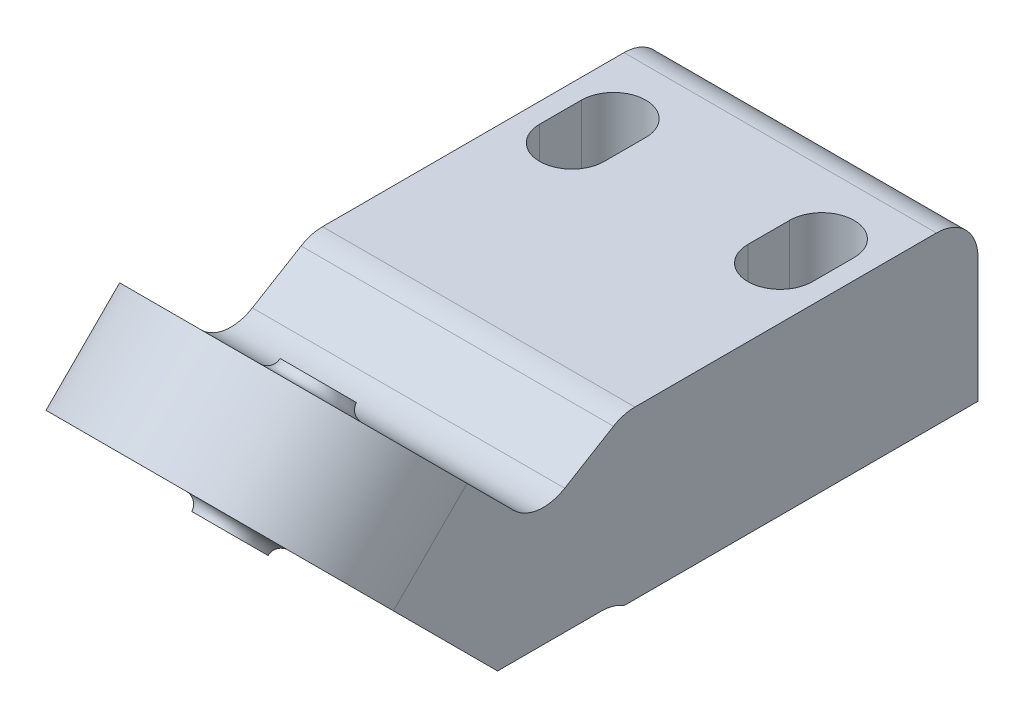
from build123d import *

# Parameters (mm, degrees)
SKETCH_10_W         = 15
SKETCH_10_H         = 8
EXTRUDE_7_DEPTH     = 11
CUT_EXTRUDE_4_DEPTH = 11
SKETCH_12_W         = 15
SKETCH_12_H         = 6
EXTRUDE_8_DEPTH     = 6
SKETCH_14_W         = 15
SKETCH_14_H         = 5
EXTRUDE_9_DEPTH     = 4
EXTRUDE_10_DEPTH    = 15
EXTRUDE_11_DEPTH    = 5
SKETCH_19_R         = 1.1
CUT_EXTRUDE_5_DEPTH = 5
EXTRUDE_START       = 0.5
SKETCH_20_R         = 1.5
SKETCH_20_R_2       = 1.1
EXTRUDE_12_DEPTH    = 0.5
SKETCH_21_R         = 1.5
SKETCH_21_R_2       = 1.1
EXTRUDE_13_DEPTH    = 0.5
FILLET_4_R          = 0.5
CHAMFER_1_SIZE      = 4.493554602
CHAMFER_1_SIZE_2    = 2.7
FILLET_7_R          = 2
SKETCH_22_W         = 15
SKETCH_22_H         = 2
EXTRUDE_14_DEPTH    = 6
FILLET_8_R          = 2
FILLET_9_R          = 2


# Some blends are built 0.0001 mm under size
with BuildPart() as part:
    # 草图10 → 凸台-拉伸7 (new body)
    with BuildSketch(Plane.XY):
        with Locations((0, 24.68211788)):
            Rectangle(SKETCH_10_W, SKETCH_10_H)
    extrude(amount=EXTRUDE_7_DEPTH)

    # 草图11 → 切除-拉伸4 (cut)
    with BuildSketch(Plane(origin=(0, 28.68211788, 0), x_dir=(1, 0, 0), z_dir=(0, 1, 0))):
        with BuildLine():
            Line((-3.45, -5), (-3.45, -7))
            ThreePointArc((-3.45, -7), (-5, -8.55), (-6.55, -7))
            Line((-6.55, -7), (-6.55, -5))
            ThreePointArc((-6.55, -5), (-5, -3.45), (-3.45, -5))
        make_face()
        with BuildLine():
            Line((3.45, -5), (3.45, -7))
            ThreePointArc((3.45, -7), (5, -8.55), (6.55, -7))
            Line((6.55, -7), (6.55, -5))
            ThreePointArc((6.55, -5), (5, -3.45), (3.45, -5))
        make_face()
    extrude(amount=-CUT_EXTRUDE_4_DEPTH, mode=Mode.SUBTRACT)

    # 草图12 → 凸台-拉伸8 (add)
    with BuildSketch(Plane.XY.offset(11)):
        with Locations((0, 25.68211788)):
            Rectangle(SKETCH_12_W, SKETCH_12_H)
    extrude(amount=EXTRUDE_8_DEPTH)

    # 草图14 → 凸台-拉伸9 (add)
    with BuildSketch(Plane.XY.offset(17)):
        with Locations((0, 23.5)):
            Rectangle(SKETCH_14_W, SKETCH_14_H)
    extrude(amount=EXTRUDE_9_DEPTH)

    # 草图17 → 凸台-拉伸10 (add)
    with BuildSketch(Plane.ZY.offset(7.5)):
        Polygon((21, 26), (24.535533906, 29.535533906), (28.071067812, 26), (23.071067812, 21), (21, 21), align=None)
    extrude(amount=-EXTRUDE_10_DEPTH)

    # 草图18 → 凸台-拉伸11 (add)
    with BuildSketch(Plane(origin=(0, -1.035533906, 1.035533906), x_dir=(1, 0, 0), z_dir=(0, -0.7071067811865507, 0.7071067811865445))):
        with BuildLine():
            Line((7.5, 38.234018716), (-7.5, 38.234018716))
            ThreePointArc((-7.5, 38.234018716), (0, 45.734018716), (7.5, 38.234018716))
        make_face()
    extrude(amount=-EXTRUDE_11_DEPTH)

    # 草图19 → 切除-拉伸5 (cut)
    with BuildSketch(Plane(origin=(0, -1.035533906, 1.035533906), x_dir=(1, 0, 0), z_dir=(0, -0.7071067811865507, 0.7071067811865445))):
        with Locations(Location((0, 38.234018716, 0), (0, 0, 270))):
            Circle(SKETCH_19_R)
    extrude(amount=-CUT_EXTRUDE_5_DEPTH, mode=Mode.SUBTRACT)

    # 草图20 → 凸台-拉伸12 (add)
    with BuildSketch(Plane(origin=(0, -1.035533906, 1.035533906), x_dir=(1, 0, 0), z_dir=(0, -0.7071067811865507, 0.7071067811865445)).offset(EXTRUDE_START)):
        with Locations(Location((0, 38.234018716, 0), (0, 0, 270))):
            Circle(SKETCH_20_R)
        with Locations(Location((0, 38.234018716, 0), (0, 0, 270))):
            Circle(SKETCH_20_R_2, mode=Mode.SUBTRACT)
    extrude(amount=-EXTRUDE_12_DEPTH)

    # 草图21 → 凸台-拉伸13 (add)
    with BuildSketch(Plane(origin=(0, 2.5, -2.5), x_dir=(1, 0, 0), z_dir=(0, 0.7071067811865513, -0.7071067811865437))):
        with Locations(Location((0, -38.234018716, 0), (0, 0, 90))):
            Circle(SKETCH_21_R)
        with Locations(Location((0, -38.234018716, 0), (0, 0, 90))):
            Circle(SKETCH_21_R_2, mode=Mode.SUBTRACT)
    extrude(amount=EXTRUDE_13_DEPTH)

    # 圆角4
    fillet_4_edges = [part.edges().sort_by_distance(p)[0] for p in [
        (0, 27.060660172, 29.131727984),
        (0, 30.596194078, 25.596194078),
    ]]
    fillet(fillet_4_edges, radius=FILLET_4_R - 0.0001)  # a hair under: the kernel refuses the full size

    # 倒角1
    # the kernel refuses this chamfer: 4.493554602, 2.7 mm, written as the material it adds along each edge
    with BuildSketch(Plane(origin=(-7.5, 26, 17), x_dir=(0, -0.01991463058083334, 0.9998016840798123), z_dir=(1, 0, 0))) as chamfer_1_piece_1_section:
        Polygon((CHAMFER_1_SIZE * 0.999801684157, -CHAMFER_1_SIZE * 0.0199146305824), (-CHAMFER_1_SIZE_2 * 0.0199146305808, -CHAMFER_1_SIZE_2 * 0.99980168408), (0, 0), align=None)
    chamfer_1_piece_1 = extrude(amount=15, mode=Mode.PRIVATE)
    chamfer_1_piece_1 = split(chamfer_1_piece_1, bisect_by=Plane(origin=(0, 28.68211788, 18.477199106), z_dir=(0, -1, 0)), keep=Keep.TOP, mode=Mode.PRIVATE)
    add(chamfer_1_piece_1)

    # 圆角7
    fillet_7_edges = [part.edges().sort_by_distance(p)[0] for p in [
        (0, 26.18524881, 21.18524881),
        (0, 28.68211788, 17.029760846),
    ]]
    fillet(fillet_7_edges, radius=FILLET_7_R)

    # 草图22 → 凸台-拉伸14 (add)
    with BuildSketch(Plane.XY.offset(11)):
        with Locations((0, 21.68211788)):
            Rectangle(SKETCH_22_W, SKETCH_22_H)
    extrude(amount=EXTRUDE_14_DEPTH)

    # 圆角8
    # the kernel refuses this fillet: 2 mm, written as the material it adds along each edge
    with BuildSketch(Plane(origin=(7.5, 21, 17), x_dir=(0, -1.0, 7.298057631676466e-12), z_dir=(-1, 0, 0))) as fillet_8_piece_1:
        with BuildLine():
            CenterArc((2, 1.08188698), FILLET_8_R, 180, 32.747889427)
            Line((0, 1.08188698), (-0.04, 1.08188698))
            Line((-0.04, 1.08188698), (-0.04, 0))
            Line((-0.04, 0), (0, -0.04))
            ThreePointArc((0, -0.04), (0.15894106, -0.04), (0.284239762, -0.02163774))
            Line((0.284239762, -0.02163774), (0.31788212, 0))
        make_face()
    extrude(amount=15)

    # 圆角9
    fillet_9_edges = [part.edges().sort_by_distance(p)[0] for p in [
        (0, 28.68211788, 0),
    ]]
    fillet(fillet_9_edges, radius=FILLET_9_R)


solid = part.part
